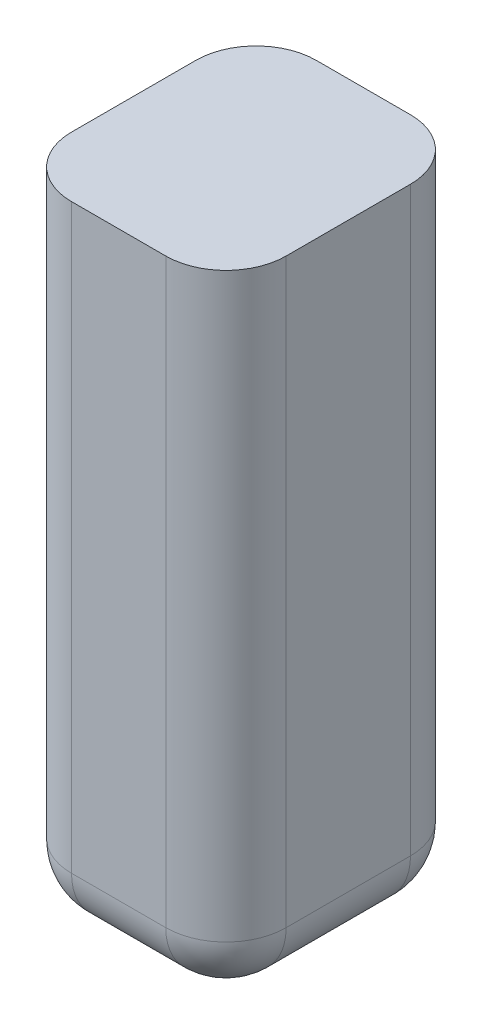
from build123d import *

# Parameters (mm, degrees)
SKETCH1_W           = 5.35
SKETCH1_H           = 6.1
SKETCH1_W_2         = 1.35
SKETCH1_H_2         = 2.1
BOSS_EXTRUDE1_DEPTH = 6
SKETCH2_W           = 5.35
SKETCH2_H           = 6.1
BOSS_EXTRUDE2_DEPTH = 10
FILLET1_R           = 1.5
FILLET2_R           = 1.5


with BuildPart() as part:
    # Sketch1 → Boss-Extrude1 (new body)
    with BuildSketch(Plane(origin=(0, 0, 0), x_dir=(1, 0, 0), z_dir=(0, 1, 0))):
        Rectangle(SKETCH1_W, SKETCH1_H)
        Rectangle(SKETCH1_W_2, SKETCH1_H_2, mode=Mode.SUBTRACT)
    extrude(amount=BOSS_EXTRUDE1_DEPTH)

    # Sketch2 → Boss-Extrude2 (add)
    with BuildSketch(Plane(origin=(0, 6, 0), x_dir=(1, 0, 0), z_dir=(0, 1, 0))):
        Rectangle(SKETCH2_W, SKETCH2_H)
    extrude(amount=BOSS_EXTRUDE2_DEPTH)

    # Fillet1
    fillet1_edges = [part.edges().sort_by_distance(p)[0] for p in [
        (0, 0, -3.05),
        (2.675, 0, 0),
        (0, 0, 3.05),
        (-2.675, 0, 0),
    ]]
    fillet(fillet1_edges, radius=FILLET1_R)

    # Fillet2
    # the kernel refuses this fillet: 1.5 mm, written as the material it takes off along each edge
    with BuildSketch(Plane(origin=(1.175, 1.5, -1.55), x_dir=(1, 0, 0), z_dir=(0, 0, -1))) as fillet2_piece_1_section:
        Polygon((0, 0), (FILLET2_R, 0), (FILLET2_R, FILLET2_R), (0, FILLET2_R), align=None)
    fillet2_piece_1 = extrude(amount=FILLET2_R, mode=Mode.PRIVATE)
    fillet2_piece_1 = fillet2_piece_1 - Plane(origin=(1.175, 1.5, -1.55), x_dir=(-0.7071067811865475, 0.7071067811865475, 0), z_dir=(0, 0, -1)) * Sphere(FILLET2_R, mode=Mode.PRIVATE)
    add(fillet2_piece_1, mode=Mode.SUBTRACT)
    with BuildSketch(Plane(origin=(1.175, 1.5, 1.55), x_dir=(0, 0, 1), z_dir=(1, 0, 0))) as fillet2_piece_2_section:
        Polygon((0, 0), (FILLET2_R, 0), (FILLET2_R, FILLET2_R), (0, FILLET2_R), align=None)
    fillet2_piece_2 = extrude(amount=FILLET2_R, mode=Mode.PRIVATE)
    fillet2_piece_2 = fillet2_piece_2 - Plane(origin=(1.175, 1.5, 1.55), x_dir=(0, 0.7071067811865475, -0.7071067811865475), z_dir=(1, 0, 0)) * Sphere(FILLET2_R, mode=Mode.PRIVATE)
    add(fillet2_piece_2, mode=Mode.SUBTRACT)
    with BuildSketch(Plane(origin=(-1.175, 1.5, -1.55), x_dir=(-1, 0, 0), z_dir=(0, 0, -1))) as fillet2_piece_3_section:
        Polygon((0, 0), (FILLET2_R, 0), (FILLET2_R, -FILLET2_R), (0, -FILLET2_R), align=None)
    fillet2_piece_3 = extrude(amount=FILLET2_R, mode=Mode.PRIVATE)
    fillet2_piece_3 = fillet2_piece_3 - Plane(origin=(-1.175, 1.5, -1.55), x_dir=(0.7071067811865475, 0.7071067811865475, 0), z_dir=(0, 0, -1)) * Sphere(FILLET2_R, mode=Mode.PRIVATE)
    add(fillet2_piece_3, mode=Mode.SUBTRACT)
    with BuildSketch(Plane(origin=(-1.175, 1.5, 1.55), x_dir=(0, 0, 1), z_dir=(-1, 0, 0))) as fillet2_piece_4_section:
        Polygon((0, 0), (FILLET2_R, 0), (FILLET2_R, -FILLET2_R), (0, -FILLET2_R), align=None)
    fillet2_piece_4 = extrude(amount=FILLET2_R, mode=Mode.PRIVATE)
    fillet2_piece_4 = fillet2_piece_4 - Plane(origin=(-1.175, 1.5, 1.55), x_dir=(0, 0.7071067811865475, -0.7071067811865475), z_dir=(-1, 0, 0)) * Sphere(FILLET2_R, mode=Mode.PRIVATE)
    add(fillet2_piece_4, mode=Mode.SUBTRACT)
    with BuildSketch(Plane(origin=(-2.675, 1.5, -3.05), x_dir=(1, 0, 0), z_dir=(0, 1, 0)), Plane(origin=(2.675, 19.75, -3.05), x_dir=(-1, 0, 0), z_dir=(0, -1, 0)), Plane(origin=(2.675, 19.75, 3.05), x_dir=(0, 0, -1), z_dir=(0, -1, 0)), Plane(origin=(-2.675, 1.5, 3.05), x_dir=(0, 0, -1), z_dir=(0, 1, 0))) as fillet2_piece_5:
        with BuildLine():
            CenterArc((FILLET2_R, -FILLET2_R), FILLET2_R, 90, 90)
            Line((0, -FILLET2_R), (0, 0))
            Line((0, 0), (FILLET2_R, 0))
        make_face()
    extrude(amount=18.25, mode=Mode.SUBTRACT)


solid = part.part
